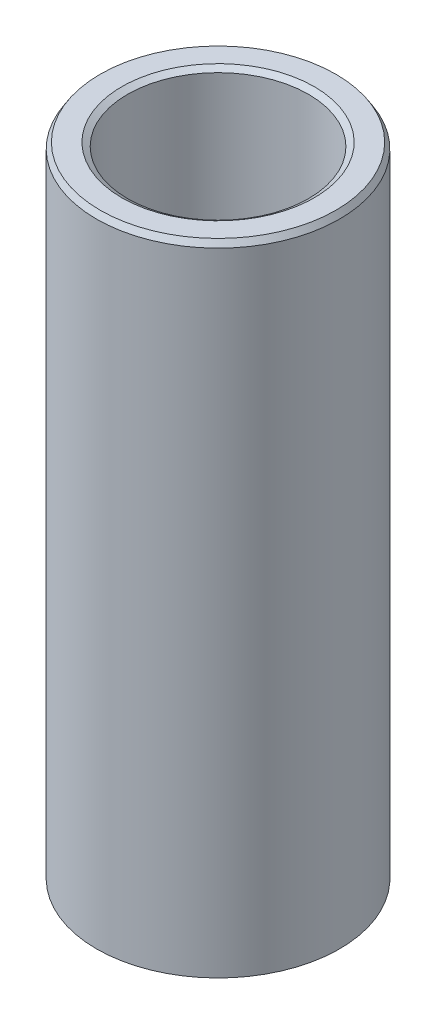
from build123d import *
from OCP.BRepFilletAPI import BRepFilletAPI_MakeChamfer

# Parameters (mm, degrees)
SKETCH1_R           = 22.5
BOSS_EXTRUDE1_DEPTH = 118.789899173
SKETCH2_R           = 16.745079588
CUT_EXTRUDE1_DEPTH  = 123.977803467
CHAMFER1_SIZE       = 1.080189429
CHAMFER1_SIZE2      = 0.6789545


with BuildPart() as part:
    # Sketch1 → Boss-Extrude1 (new body)
    with BuildSketch(Plane(origin=(0, 0, 0), x_dir=(1, 0, 0), z_dir=(0, 1, 0))):
        Circle(SKETCH1_R)
    extrude(amount=BOSS_EXTRUDE1_DEPTH)

    # Sketch2 → Cut-Extrude1 (cut, through all)
    with BuildSketch(Plane(origin=(0, 0, 0), x_dir=(1, 0, 0), z_dir=(0, 1, 0))):
        Circle(SKETCH2_R)
    extrude(amount=CUT_EXTRUDE1_DEPTH, mode=Mode.SUBTRACT)

    # Chamfer1: one chamfer whose edges measure the first distance from different faces: ONE call of the kernel's chamfer builder (chamfer() names one face for all edges)
    chamfer1_edges_1 = [part.edges().sort_by_distance(p)[0] for p in [
        (-16.745079588, 118.789899173, 0),
    ]]
    chamfer1_side_1 = [part.faces().sort_by_distance(p)[0] for p in [
        (-21.863603897, 118.789899173, 0),
    ]]
    chamfer1_edges_2 = [part.edges().sort_by_distance(p)[0] for p in [
        (-16.745079588, 0, 0),
    ]]
    chamfer1_side_2 = [part.faces().sort_by_distance(p)[0] for p in [
        (-16.745079588, 59.394949587, 0),
    ]]
    chamfer1_edges_3 = [part.edges().sort_by_distance(p)[0] for p in [
        (-22.5, 0, 0),
    ]]
    chamfer1_side_3 = [part.faces().sort_by_distance(p)[0] for p in [
        (-21.863603897, 0, 0),
    ]]
    chamfer1_edges_4 = [part.edges().sort_by_distance(p)[0] for p in [
        (-22.5, 118.789899173, 0),
    ]]
    chamfer1_side_4 = [part.faces().sort_by_distance(p)[0] for p in [
        (-22.5, 59.394949587, 0),
    ]]
    chamfer1 = BRepFilletAPI_MakeChamfer(part.part.solid().wrapped)
    for e in chamfer1_edges_1:
        chamfer1.Add(CHAMFER1_SIZE, CHAMFER1_SIZE2, e.wrapped, chamfer1_side_1[0].wrapped)  # the first distance lies on this face
    for e in chamfer1_edges_2:
        chamfer1.Add(CHAMFER1_SIZE, CHAMFER1_SIZE2, e.wrapped, chamfer1_side_2[0].wrapped)  # the first distance lies on this face
    for e in chamfer1_edges_3:
        chamfer1.Add(CHAMFER1_SIZE, CHAMFER1_SIZE2, e.wrapped, chamfer1_side_3[0].wrapped)  # the first distance lies on this face
    for e in chamfer1_edges_4:
        chamfer1.Add(CHAMFER1_SIZE, CHAMFER1_SIZE2, e.wrapped, chamfer1_side_4[0].wrapped)  # the first distance lies on this face
    add(Compound.cast(chamfer1.Shape()), mode=Mode.REPLACE)


solid = part.part
